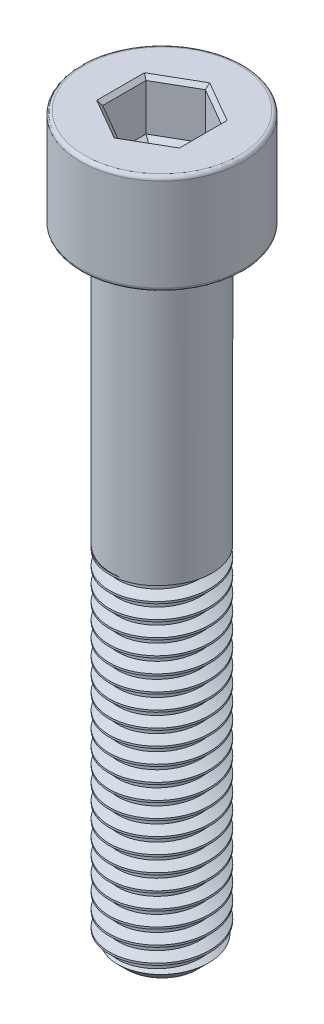
from build123d import *

# Parameters (mm, degrees)
SKETCH1_R           = 4
BOSS_EXTRUDE1_DEPTH = 28
THREAD1_PITCH       = 1.25
SKETCH2_R           = 4
BOSS_EXTRUDE2_DEPTH = 22
SKETCH5_R           = 6.5
BOSS_EXTRUDE3_DEPTH = 8
FILLET1_R           = 0.3
CUT_EXTRUDE1_DEPTH  = 4
CHAMFER1_SIZE       = 0.3
CUT_EXTRUDE2_DEPTH  = 0.4
CUT_EXTRUDE2_DRAFT  = -60


with BuildPart() as part:
    # Sketch1 → Boss-Extrude1 (new body)
    with BuildSketch(Plane(origin=(0, 0, 0), x_dir=(1, 0, 0), z_dir=(0, 1, 0))):
        with Locations(Location((0, 0, 0), (0, 0, 270))):
            Circle(SKETCH1_R)
    extrude(amount=BOSS_EXTRUDE1_DEPTH)

    # Thread1: the profile of Thread Profile1 profile screwed along a right-hand helix of 24 turns, 8 arcs to a turn; built about Z, then put on its axis
    thread1_z = Axis((0, 0, 0), (0, 0, 1))
    thread1_corners = [(4.0003, 0, -0.000173205), (4.0003, 0, 1.093923202), (3.323417656, 0, 0.703124998), (3.323417656, 0, 0.390624998)]
    with BuildLine(mode=Mode.PRIVATE) as thread1_profile:
        Line(thread1_corners[0], thread1_corners[1])
        Line(thread1_corners[1], thread1_corners[2])
        Line(thread1_corners[2], thread1_corners[3])
        Line(thread1_corners[3], thread1_corners[0])
    thread1_cap = Face(thread1_profile.wire())
    thread1_turn_angles = [0, 22.5, 45, 67.5, 90, 112.5, 135, 157.5, 180, 202.5, 225, 247.5, 270, 292.5, 315, 337.5, 360]
    thread1_turn_weights = [1, 0.9238795325112867, 1, 0.9238795325112867, 1, 0.9238795325112867, 1, 0.9238795325112867, 1, 0.9238795325112867, 1, 0.9238795325112867, 1, 0.9238795325112867, 1, 0.9238795325112867, 1]
    thread1_turn_rails = [Edge.make_bspline([Vector(p[0], p[1], 0).rotate(thread1_z, thread1_turn_angles[k]) / thread1_turn_weights[k] + Vector(0, 0, p[2] + THREAD1_PITCH * thread1_turn_angles[k] / 360) for k in range(17)], [0, 0, 0, 1, 1, 2, 2, 3, 3, 4, 4, 5, 5, 6, 6, 7, 7, 8, 8, 8], 2, thread1_turn_weights) for p in thread1_corners]
    thread1_turn_sides = [Face.make_surface_from_curves(thread1_turn_rails[p[0]], thread1_turn_rails[p[1]]) for p in [(0, 1), (1, 2), (2, 3), (3, 0)]]
    thread1 = Plane(origin=(0, 30, 0), x_dir=(-1, 0, 0), z_dir=(0, -1, 0)) * Solid(Shell([*[p.moved(Location((0, 0, THREAD1_PITCH * i))) for i in range(24) for p in thread1_turn_sides], thread1_cap, thread1_cap.rotate(thread1_z, 8640).moved(Location((0, 0, THREAD1_PITCH * 8640 / 360)))]))
    add(thread1, mode=Mode.SUBTRACT)

    # Sketch2 → Boss-Extrude2 (add)
    with BuildSketch(Plane(origin=(0, 28, 0), x_dir=(1, 0, 0), z_dir=(0, 1, 0))):
        with Locations(Location((0, 0, 0), (0, 0, 117.593571361))):
            Circle(SKETCH2_R)
    extrude(amount=BOSS_EXTRUDE2_DEPTH)

    # Sketch5 → Boss-Extrude3 (add)
    with BuildSketch(Plane(origin=(0, 50, 0), x_dir=(1, 0, 0), z_dir=(0, 1, 0))):
        with Locations(Location((0, 0, 0), (0, 0, 270))):
            Circle(SKETCH5_R)
    extrude(amount=BOSS_EXTRUDE3_DEPTH)

    # Sketch6 → Cut-Revolve1 (revolve, cut)
    with BuildSketch(Plane.XY, mode=Mode.PRIVATE) as cut_revolve1_sk:
        Polygon((4.01, 0), (4.01, 1.2), (2.81, 0), align=None)
    revolve(cut_revolve1_sk.sketch.rotate(Axis((0, 0, 0), (0, 1, 0)), 117.593571361), axis=Axis((0, 0, 0), (0, 1, 0)), mode=Mode.SUBTRACT)

    # Fillet1
    fillet1_edges = [part.edges().sort_by_distance(p)[0] for p in [
        (0, 50, -6.5),
        (0, 58, -6.5),
    ]]
    fillet(fillet1_edges, radius=FILLET1_R)

    # Sketch7 → Cut-Extrude1 (cut)
    with BuildSketch(Plane(origin=(0, 58, 0), x_dir=(1, 0, 0), z_dir=(0, 1, 0))):
        Polygon((0, 3.464101615), (-3, 1.732050808), (-3, -1.732050808), (0, -3.464101615), (3, -1.732050808), (3, 1.732050808), align=None)
    extrude(amount=-CUT_EXTRUDE1_DEPTH, mode=Mode.SUBTRACT)

    # Chamfer1
    chamfer1_edges = [part.edges().sort_by_distance(p)[0] for p in [
        (1.5, 58, -2.598076211),
        (-1.5, 58, -2.598076211),
        (-3, 58, 0),
        (-1.5, 58, 2.598076211),
        (1.5, 58, 2.598076211),
        (3, 58, 0),
    ]]
    chamfer(chamfer1_edges, length=CHAMFER1_SIZE)


with BuildPart() as cut_extrude2_tool:
    # Sketch8 → Cut-Extrude2 (with draft: the straight prism first)
    with BuildSketch(Plane(origin=(0, 54, 0), x_dir=(1, 0, 0), z_dir=(0, 1, 0))):
        Polygon((0, 3.464101615), (-3, 1.732050808), (-3, -1.732050808), (0, -3.464101615), (3, -1.732050808), (3, 1.732050808), align=None)
    extrude(amount=-CUT_EXTRUDE2_DEPTH)
    # Cut-Extrude2: the draft: its side faces are tilted about the plane it starts from
    cut_extrude2_sides = [cut_extrude2_tool.faces().sort_by_distance(p)[0] for p in [
        (-1.5, 53.8, -2.598076211),
        (-3, 53.8, 0),
        (-1.5, 53.8, 2.598076211),
        (1.5, 53.8, 2.598076211),
        (3, 53.8, 0),
        (1.5, 53.8, -2.598076211),
    ]]
    draft(cut_extrude2_sides, Plane(origin=(0, 54, 0), x_dir=(1, 0, 0), z_dir=(0, 1, 0)), CUT_EXTRUDE2_DRAFT)


with BuildPart() as part_1:
    add(part.part)

    # Cut-Extrude2: cut by cut_extrude2_tool
    add(cut_extrude2_tool.part, mode=Mode.SUBTRACT)


solid = part_1.part
